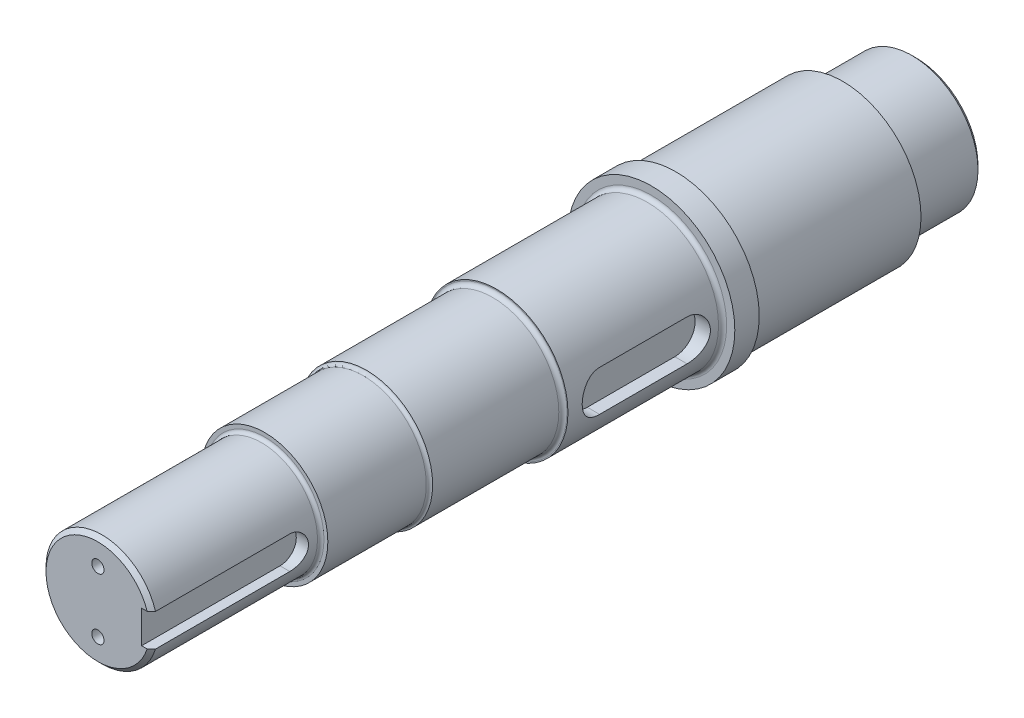
from build123d import *

# Parameters (mm, degrees)
SKETCH_1_R          = 32.5
EXTRUDE_1_DEPTH     = 36
SKETCH_2_R          = 38.5
EXTRUDE_2_DEPTH     = 82
SKETCH_3_R          = 41
EXTRUDE_3_DEPTH     = 12
SKETCH_4_R          = 35
EXTRUDE_4_DEPTH     = 76
SKETCH_5_R          = 32.5
EXTRUDE_5_DEPTH     = 64
SKETCH_6_R          = 31
EXTRUDE_6_DEPTH     = 50
SKETCH_7_R          = 27.5
EXTRUDE_7_DEPTH     = 82
FILLET_1_R          = 2
FILLET_2_R          = 1.6
CHAMFER_1_SIZE      = 2
CUT_EXTRUDE_1_DEPTH = 29
CUT_EXTRUDE_2_DEPTH = 20
SKETCH_10_R         = 3
CUT_EXTRUDE_3_DEPTH = 20


with BuildPart() as part:
    # 草图1 → 凸台-拉伸1 (new body)
    with BuildSketch(Plane.XY):
        Circle(SKETCH_1_R)
    extrude(amount=EXTRUDE_1_DEPTH)

    # 草图2 → 凸台-拉伸2 (add)
    with BuildSketch(Plane.XY.offset(36)):
        Circle(SKETCH_2_R)
    extrude(amount=EXTRUDE_2_DEPTH)

    # 草图3 → 凸台-拉伸3 (add)
    with BuildSketch(Plane.XY.offset(118)):
        Circle(SKETCH_3_R)
    extrude(amount=EXTRUDE_3_DEPTH)

    # 草图4 → 凸台-拉伸4 (add)
    with BuildSketch(Plane.XY.offset(130)):
        Circle(SKETCH_4_R)
    extrude(amount=EXTRUDE_4_DEPTH)

    # 草图5 → 凸台-拉伸5 (add)
    with BuildSketch(Plane.XY.offset(206)):
        Circle(SKETCH_5_R)
    extrude(amount=EXTRUDE_5_DEPTH)

    # 草图6 → 凸台-拉伸6 (add)
    with BuildSketch(Plane.XY.offset(270)):
        Circle(SKETCH_6_R)
    extrude(amount=EXTRUDE_6_DEPTH)

    # 草图7 → 凸台-拉伸7 (add)
    with BuildSketch(Plane.XY.offset(320)):
        Circle(SKETCH_7_R)
    extrude(amount=EXTRUDE_7_DEPTH)

    # 圆角1
    fillet_1_edges = [part.edges().sort_by_distance(p)[0] for p in [
        (-35, 0, 130),
        (-32.5, 0, 206),
    ]]
    fillet(fillet_1_edges, radius=FILLET_1_R)

    # 圆角2
    # the kernel refuses this fillet: 1.6 mm, written as the material it adds along each edge
    with BuildSketch(Plane(origin=(0, 0, 270), x_dir=(1, 0, 0), z_dir=(0, -1, 0))) as fillet_2_piece_1:
        with BuildLine():
            CenterArc((32.6, 1.596871942), FILLET_2_R, 180, 86.416678302)
            Line((31, 1.596871942), (30.968, 1.596871942))
            Line((30.968, 1.596871942), (30.968, 0))
            Line((30.968, 0), (31, -0.032))
            ThreePointArc((31, -0.032), (31.75, -0.032), (32.498, -0.031937439))
            Line((32.498, -0.031937439), (32.5, 0))
        make_face()
    revolve(axis=Axis((0, 0, 270), (0, 0, 1)))
    with BuildSketch(Plane(origin=(0, 0, 320), x_dir=(1, 0, 0), z_dir=(0, -1, 0))) as fillet_2_piece_2:
        with BuildLine():
            CenterArc((27.5 + FILLET_2_R, FILLET_2_R), FILLET_2_R, 180, 90)
            Line((27.5, FILLET_2_R), (27.5 - FILLET_2_R * 0.02, FILLET_2_R))
            Line((27.5 - FILLET_2_R * 0.02, FILLET_2_R), (27.5 - FILLET_2_R * 0.02, -FILLET_2_R * 0.02))
            Line((27.5 - FILLET_2_R * 0.02, -FILLET_2_R * 0.02), (27.5 + FILLET_2_R, -FILLET_2_R * 0.02))
            Line((27.5 + FILLET_2_R, -FILLET_2_R * 0.02), (27.5 + FILLET_2_R, 0))
        make_face()
    revolve(axis=Axis((0, 0, 320), (0, 0, 1)))

    # 倒角1
    chamfer_1_edges = [part.edges().sort_by_distance(p)[0] for p in [
        (-32.5, 0, 0),
        (-27.5, 0, 402),
    ]]
    chamfer(chamfer_1_edges, length=CHAMFER_1_SIZE)

    # 草图8 → 切除-拉伸1 (cut)
    with BuildSketch(Plane(origin=(27.5, 0, 0), x_dir=(0, 0, -1), z_dir=(1, 0, 0))):
        with BuildLine():
            Line((-189, 10), (-146, 10))
            ThreePointArc((-146, 10), (-136, 0), (-146, -10))
            Line((-146, -10), (-189, -10))
            ThreePointArc((-189, -10), (-199, 0), (-189, 10))
        make_face()
    extrude(amount=CUT_EXTRUDE_1_DEPTH, mode=Mode.SUBTRACT)

    # 草图9 → 切除-拉伸2 (cut)
    with BuildSketch(Plane(origin=(21.5, 0, 0), x_dir=(0, 0, -1), z_dir=(1, 0, 0))):
        with BuildLine():
            Line((-402, 8), (-334, 8))
            ThreePointArc((-334, 8), (-326, 0), (-334, -8))
            Line((-334, -8), (-402, -8))
            Line((-402, -8), (-402, 8))
        make_face()
    extrude(amount=CUT_EXTRUDE_2_DEPTH, mode=Mode.SUBTRACT)

    # 草图10 → 切除-拉伸3 (cut)
    with BuildSketch(Plane.XY.offset(402)):
        with Locations((0, 15)):
            Circle(SKETCH_10_R)
        with Locations((0, -15)):
            Circle(SKETCH_10_R)
    extrude(amount=-CUT_EXTRUDE_3_DEPTH, mode=Mode.SUBTRACT)


solid = part.part
